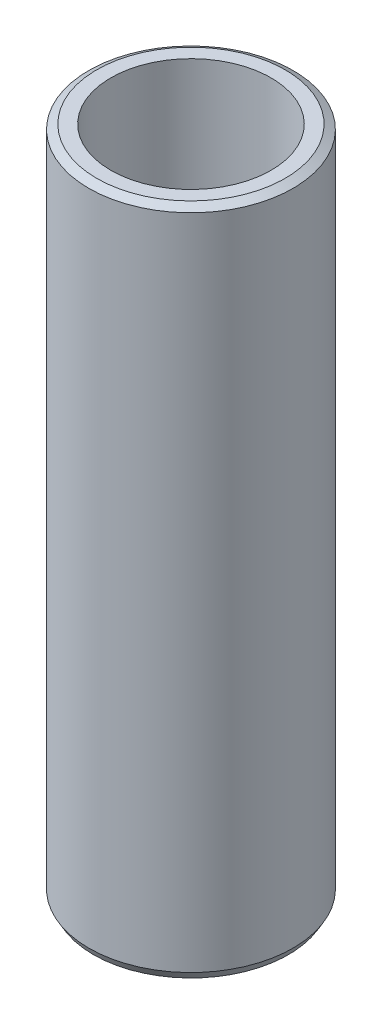
from build123d import *
from OCP.BRepFilletAPI import BRepFilletAPI_MakeChamfer

# Parameters (mm, degrees)
SKETCH1_R           = 30
BOSS_EXTRUDE1_DEPTH = 196.950000523
SKETCH2_R           = 23.536763213
CUT_EXTRUDE1_DEPTH  = 202.467870158
CHAMFER1_SIZE       = 1.35415316
CHAMFER1_SIZE2      = 2.345462074


with BuildPart() as part:
    # Sketch1 → Boss-Extrude1 (new body)
    with BuildSketch(Plane(origin=(0, 0, 0), x_dir=(1, 0, 0), z_dir=(0, 1, 0))):
        Circle(SKETCH1_R)
    extrude(amount=BOSS_EXTRUDE1_DEPTH)

    # Sketch2 → Cut-Extrude1 (cut, through all)
    with BuildSketch(Plane(origin=(0, 0, 0), x_dir=(1, 0, 0), z_dir=(0, 1, 0))):
        Circle(SKETCH2_R)
    extrude(amount=CUT_EXTRUDE1_DEPTH, mode=Mode.SUBTRACT)

    # Chamfer1: one chamfer whose edges measure the first distance from different faces: ONE call of the kernel's chamfer builder (chamfer() names one face for all edges)
    chamfer1_edges_1 = [part.edges().sort_by_distance(p)[0] for p in [
        (-30, 196.950000523, 0),
    ]]
    chamfer1_side_1 = [part.faces().sort_by_distance(p)[0] for p in [
        (-30, 98.475000261, 0),
    ]]
    chamfer1_edges_2 = [part.edges().sort_by_distance(p)[0] for p in [
        (-30, 0, 0),
    ]]
    chamfer1_side_2 = [part.faces().sort_by_distance(p)[0] for p in [
        (-29.151471863, 0, 0),
    ]]
    chamfer1 = BRepFilletAPI_MakeChamfer(part.part.solid().wrapped)
    for e in chamfer1_edges_1:
        chamfer1.Add(CHAMFER1_SIZE, CHAMFER1_SIZE2, e.wrapped, chamfer1_side_1[0].wrapped)  # the first distance lies on this face
    for e in chamfer1_edges_2:
        chamfer1.Add(CHAMFER1_SIZE, CHAMFER1_SIZE2, e.wrapped, chamfer1_side_2[0].wrapped)  # the first distance lies on this face
    add(Compound.cast(chamfer1.Shape()), mode=Mode.REPLACE)


solid = part.part
